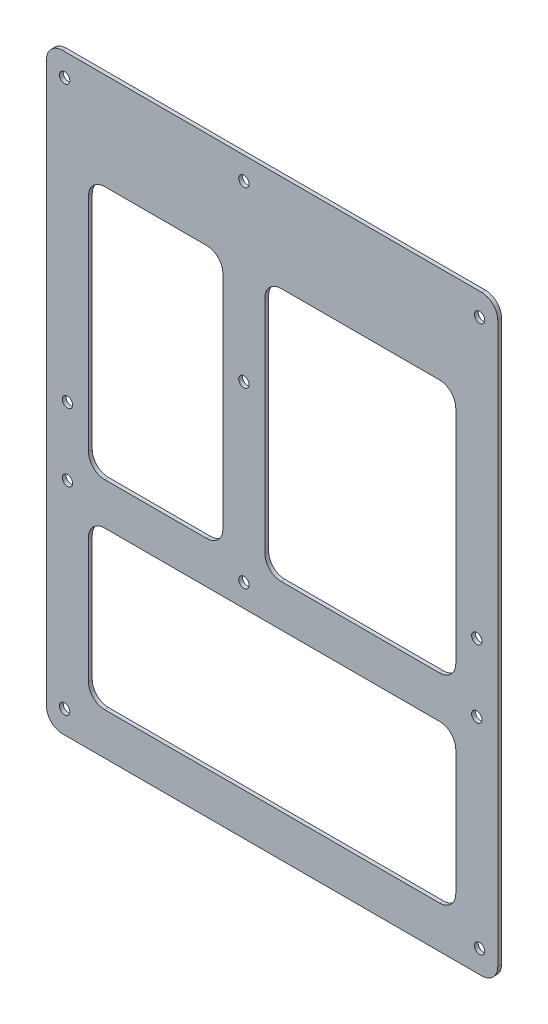
from build123d import *

# Parameters (mm, degrees)
SKETCH1_W                = 69.825
SKETCH1_H                = 183.16
FRONT_PLATE_DEPTH        = 1.2
CUT_EXTRUDE1_REACH       = 197.283
SKETCH3_W                = 56.825
SKETCH3_H                = 78.5
SKETCH3_H_2              = 48.66
CONVERT_SOLID5_START     = 1.1684
CONVERT_SOLID5_DEPTH     = 0.0316
M3_CLEARANCE_HOLE1_D     = 3.2
M3_CLEARANCE_HOLE1_DEPTH = 5
M3_CLEARANCE_HOLE1_TIP   = 0.96137699
SKETCH62_W               = 13
SKETCH62_H               = 78.5
BOSS_EXTRUDE2_DEPTH      = 1.1684
FILLET1_R                = 5
M3_CLEARANCE_HOLE2_D     = 3.2
M3_CLEARANCE_HOLE2_DEPTH = 5
M3_CLEARANCE_HOLE2_TIP   = 0.96137699


# Read off the part's stored shape, not the designer's step: Convert-Solid5
with BuildPart() as part:
    # Sketch1 → front_plate (new body)
    with BuildSketch(Plane.XY):
        with Locations((34.9125, -90.788691865)):
            Rectangle(SKETCH1_W, SKETCH1_H)
    extrude(amount=FRONT_PLATE_DEPTH)

    # Sketch3 → Cut-Extrude1 (cut, up to next)
    with BuildSketch(Plane.XY.offset(1.2), mode=Mode.PRIVATE) as cut_extrude1_sk1:
        with Locations((28.4125, -68.458691865)):
            Rectangle(SKETCH3_W, SKETCH3_H)
    cut_extrude1_tool1 = extrude(cut_extrude1_sk1.sketch, amount=-CUT_EXTRUDE1_REACH, mode=Mode.PRIVATE) & part.part
    # Sketch3 → Cut-Extrude1 (cut, up to next)
    with BuildSketch(Plane.XY.offset(1.2), mode=Mode.PRIVATE) as cut_extrude1_sk2:
        with Locations((28.4125, -145.038691865)):
            Rectangle(SKETCH3_W, SKETCH3_H_2)
    cut_extrude1_tool2 = extrude(cut_extrude1_sk2.sketch, amount=-CUT_EXTRUDE1_REACH, mode=Mode.PRIVATE) & part.part
    add(cut_extrude1_tool1.solids().sort_by_distance((28.4125, -68.458692, 1.2))[0], mode=Mode.SUBTRACT)
    add(cut_extrude1_tool2.solids().sort_by_distance((28.4125, -145.038692, 1.2))[0], mode=Mode.SUBTRACT)

    # Convert-Solid5 outline → Convert-Solid5 (cut)
    with BuildSketch(Plane.XY.offset(CONVERT_SOLID5_START)):
        Polygon((56.825, -107.708691865), (0, -107.708691865), (0, -120.708691865), (56.825, -120.708691865), (56.825, -169.368691865), (0, -169.368691865), (0, -182.368691865), (69.825, -182.368691865), (69.825, 0.791308135), (0, 0.791308135), (0, -29.208691865), (56.825, -29.208691865), align=None)
    extrude(amount=CONVERT_SOLID5_DEPTH, mode=Mode.SUBTRACT)

    # M3 Clearance Hole1
    with Locations(Plane.XY.offset(1.1684)):
        with Locations((63.325, -92.708691865), (63.325, -113.708691865), (64.2, -6.233691865), (64.2, -175.343691865)):
            Hole(M3_CLEARANCE_HOLE1_D / 2, depth=M3_CLEARANCE_HOLE1_DEPTH)
            with Locations((0, 0, -(M3_CLEARANCE_HOLE1_DEPTH + M3_CLEARANCE_HOLE1_TIP / 2))):  # 118° drill point
                Cone(0, M3_CLEARANCE_HOLE1_D / 2, M3_CLEARANCE_HOLE1_TIP, mode=Mode.SUBTRACT)

    # Mirror2: part across plane


with BuildPart() as part_1:
    add(part.part)
    add(part.part.mirror(Plane(origin=(0, 0.791308135, 0), x_dir=(0, 0, 1), z_dir=(-1, 0, 0))))

    # Sketch62 → Boss-Extrude2 (add)
    with BuildSketch(Plane.XY.offset(1.1684)):
        with Locations((-8.74, -68.458691865)):
            Rectangle(SKETCH62_W, SKETCH62_H)
    extrude(amount=-BOSS_EXTRUDE2_DEPTH)

    # Fillet1
    fillet1_edges = [part_1.edges().sort_by_distance(p)[0] for p in [
        (-15.24, -107.708691865, 0.5842),
        (-15.24, -29.208691865, 0.5842),
        (-2.24, -29.208691865, 0.5842),
        (-2.24, -107.708691865, 0.5842),
        (56.825, -120.708691865, 0.5842),
        (56.825, -169.368691865, 0.5842),
        (69.825, -182.368691865, 0.5842),
        (69.825, 0.791308135, 0.5842),
        (56.825, -29.208691865, 0.5842),
        (56.825, -107.708691865, 0.5842),
        (-56.825, -107.708691865, 0.5842),
        (-56.825, -29.208691865, 0.5842),
        (-69.825, 0.791308135, 0.5842),
        (-69.825, -182.368691865, 0.5842),
        (-56.825, -169.368691865, 0.5842),
        (-56.825, -120.708691865, 0.5842),
    ]]
    fillet(fillet1_edges, radius=FILLET1_R)

    # M3 Clearance Hole2
    with Locations(Plane.XY.offset(1.1684)):
        with Locations((-8.74, -6.233691865), (-8.74, -59.958691865), (-8.74, -113.708691865)):
            Hole(M3_CLEARANCE_HOLE2_D / 2, depth=M3_CLEARANCE_HOLE2_DEPTH)
            with Locations((0, 0, -(M3_CLEARANCE_HOLE2_DEPTH + M3_CLEARANCE_HOLE2_TIP / 2))):  # 118° drill point
                Cone(0, M3_CLEARANCE_HOLE2_D / 2, M3_CLEARANCE_HOLE2_TIP, mode=Mode.SUBTRACT)


solid = part_1.part
